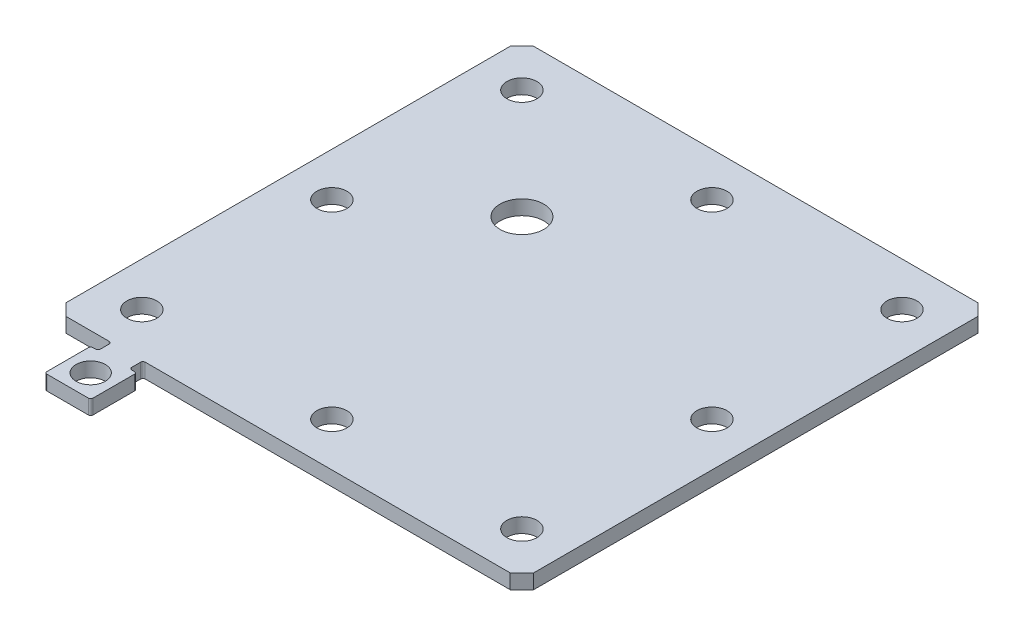
from build123d import *

# Parameters (mm, degrees)
SKETCH1_R           = 3.2639
SKETCH1_R_2         = 4.7625
SKETCH1_R_3         = 3.175
BOSS_EXTRUDE1_DEPTH = 3.175


with BuildPart() as part:
    # Sketch1 → Boss-Extrude1 (new body)
    with BuildSketch(Plane(origin=(0, 0, 0), x_dir=(1, 0, 0), z_dir=(0, 1, 0))):
        with BuildLine():
            Line((45.512230629, -44.650869632), (45.512230629, -53.650869632))
            ThreePointArc((45.512230629, -53.650869632), (45.658677239, -54.004423023), (46.012230629, -54.150869632))
            Line((46.012230629, -54.150869632), (55.012230629, -54.150869632))
            ThreePointArc((55.012230629, -54.150869632), (55.36578402, -54.004423023), (55.512230629, -53.650869632))
            Line((55.512230629, -53.650869632), (55.512230629, -44.650869632))
            ThreePointArc((55.512230629, -44.650869632), (55.36578402, -44.297316242), (55.012230629, -44.150869632))
            Line((55.012230629, -44.150869632), (54.424730629, -44.150869632))
            ThreePointArc((54.424730629, -44.150869632), (54.071177239, -44.004423023), (53.924730629, -43.650869632))
            Line((53.924730629, -43.650869632), (53.924730629, -41.712836161))
            ThreePointArc((53.924730629, -41.712836161), (54.071177239, -41.359282771), (54.424730629, -41.212836161))
            Line((54.424730629, -41.212836161), (133.697230629, -41.212836161))
            Line((133.697230629, -41.212836161), (136.237230629, -38.672836161))
            Line((136.237230629, -38.672836161), (136.237230629, 57.847163839))
            Line((136.237230629, 57.847163839), (133.697230629, 60.387163839))
            Line((133.697230629, 60.387163839), (37.177230629, 60.387163839))
            Line((37.177230629, 60.387163839), (34.637230629, 57.847163839))
            Line((34.637230629, 57.847163839), (34.637230629, -38.672836161))
            Line((34.637230629, -38.672836161), (37.177230629, -41.212836161))
            Line((37.177230629, -41.212836161), (46.599730629, -41.212836161))
            ThreePointArc((46.599730629, -41.212836161), (46.95328402, -41.359282771), (47.099730629, -41.712836161))
            Line((47.099730629, -41.712836161), (47.099730629, -43.650869632))
            ThreePointArc((47.099730629, -43.650869632), (46.95328402, -44.004423023), (46.599730629, -44.150869632))
            Line((46.599730629, -44.150869632), (46.012230629, -44.150869632))
            ThreePointArc((46.012230629, -44.150869632), (45.658677239, -44.297316242), (45.512230629, -44.650869632))
        make_face()
        with Locations((44.162230629, 9.587163839)):
            Circle(SKETCH1_R, mode=Mode.SUBTRACT)
        with Locations((44.162230629, -31.687836161)):
            Circle(SKETCH1_R, mode=Mode.SUBTRACT)
        with Locations((85.437230629, -31.687836161)):
            Circle(SKETCH1_R, mode=Mode.SUBTRACT)
        with Locations((126.712230629, -31.687836161)):
            Circle(SKETCH1_R, mode=Mode.SUBTRACT)
        with Locations((126.712230629, 9.587163839)):
            Circle(SKETCH1_R, mode=Mode.SUBTRACT)
        with Locations((126.712230629, 50.862163839)):
            Circle(SKETCH1_R, mode=Mode.SUBTRACT)
        with Locations((85.437230629, 50.862163839)):
            Circle(SKETCH1_R, mode=Mode.SUBTRACT)
        with Locations((44.162230629, 50.862163839)):
            Circle(SKETCH1_R, mode=Mode.SUBTRACT)
        with Locations((67.974730629, 27.049663839)):
            Circle(SKETCH1_R_2, mode=Mode.SUBTRACT)
        with Locations((50.512230629, -49.150869632)):
            Circle(SKETCH1_R_3, mode=Mode.SUBTRACT)
    extrude(amount=BOSS_EXTRUDE1_DEPTH)


solid = part.part
